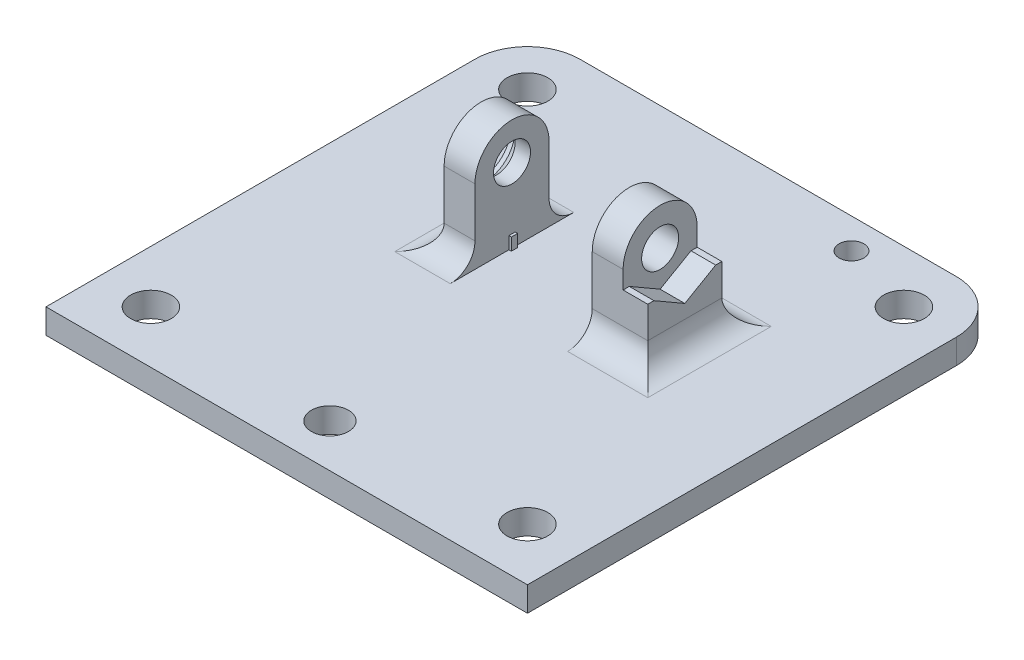
from build123d import *

# Parameters (mm, degrees)
SKETCH1_R          = 1.5
SKETCH1_R_2        = 1
SKETCH1_R_3        = 1.65
SHAPE_DEPTH        = 2
SKETCH3_W          = 2.5
SKETCH3_H          = 6
SKETCH3_W_2        = 2
SUPPORTS_DEPTH     = 9
SUPPORT_CUTS_REACH = 36.883
FILLET1_R          = 2
NUT_START          = -2
SKETCH5_R          = 1.5
NUT_HOLDER_DEPTH   = 2
SKETCH6_R          = 2.4
SCREW_CUT_DEPTH    = 0.35
SCEW_CHAMFER_SIZE  = 0.9
SKETCH7_W          = 0.5
SKETCH7_H          = 1
ANGLE_FIX_1_DEPTH  = 0.2
SKETCH8_W          = 0.5
SKETCH8_H          = 1
ANGLE_FIX_2_DEPTH  = 0.2


with BuildPart() as part:
    # Sketch1 → Shape (new body)
    with BuildSketch(Plane(origin=(0, 0, 0), x_dir=(1, 0, 0), z_dir=(0, 1, 0))):
        with BuildLine():
            Line((15.25000005, 19.5), (-15.25, 19.5))
            ThreePointArc((-15.25, 19.5), (-18.25520382, 18.25520382), (-19.5, 15.25))
            Line((-19.5, 15.25), (-19.5, -19.5))
            Line((-19.5, -19.5), (19.5, -19.5))
            Line((19.5, -19.5), (19.5, 15.25))
            ThreePointArc((19.5, 15.25), (18.255203838, 18.255203802), (15.25000005, 19.5))
        make_face()
        with Locations(Location((0, -16, 0), (0, 0, 270))):
            Circle(SKETCH1_R, mode=Mode.SUBTRACT)
        with Locations(Location((9.2, 17.05, 0), (0, 0, 270))):
            Circle(SKETCH1_R_2, mode=Mode.SUBTRACT)
        with Locations(Location((-15.25, 15.25, 0), (0, 0, 270))):
            Circle(SKETCH1_R_3, mode=Mode.SUBTRACT)
        with Locations(Location((15.25, 15.25, 0), (0, 0, 270))):
            Circle(SKETCH1_R_3, mode=Mode.SUBTRACT)
        with Locations(Location((-15.25, -15.25, 0), (0, 0, 270))):
            Circle(SKETCH1_R_3, mode=Mode.SUBTRACT)
        with Locations(Location((15.25, -15.25, 0), (0, 0, 270))):
            Circle(SKETCH1_R_3, mode=Mode.SUBTRACT)
    extrude(amount=SHAPE_DEPTH)

    # Sketch3 → Supports (add)
    with BuildSketch(Plane(origin=(0, 2, 0), x_dir=(1, 0, 0), z_dir=(0, 1, 0))):
        with Locations((-6, 3.5)):
            Rectangle(SKETCH3_W, SKETCH3_H)
        with Locations((6, 3.5)):
            Rectangle(SKETCH3_W, SKETCH3_H)
        with Locations((8.25, 3.5)):
            Rectangle(SKETCH3_W_2, SKETCH3_H)
    extrude(amount=SUPPORTS_DEPTH)

    # Support cuts: up to this face of the body (flat: up to its plane)
    support_cuts_end = Plane(part.part.faces().sort_by_distance((9.25, 6.5, -3.5))[0])
    # Sketch4 → Support cuts (cut, up to the picked face)
    with BuildSketch(Plane.ZY.offset(7.25), mode=Mode.PRIVATE) as support_cuts_sk1:
        with BuildLine():
            ThreePointArc((-2, 8), (-2.439339828, 9.060660172), (-3.5, 9.5))
            Line((-3.5, 9.5), (-3.5, 6.5))
            ThreePointArc((-3.5, 6.5), (-2.439339828, 6.939339828), (-2, 8))
        make_face()
    support_cuts_tool1 = split(extrude(support_cuts_sk1.sketch, amount=-SUPPORT_CUTS_REACH, mode=Mode.PRIVATE), bisect_by=support_cuts_end, keep=Keep.BOTH, mode=Mode.PRIVATE)
    # Sketch4 → Support cuts (cut, up to the picked face)
    with BuildSketch(Plane.ZY.offset(7.25), mode=Mode.PRIVATE) as support_cuts_sk2:
        with BuildLine():
            Line((-3.5, 6.5), (-3.5, 9.5))
            ThreePointArc((-3.5, 9.5), (-5, 8), (-3.5, 6.5))
        make_face()
    support_cuts_tool2 = split(extrude(support_cuts_sk2.sketch, amount=-SUPPORT_CUTS_REACH, mode=Mode.PRIVATE), bisect_by=support_cuts_end, keep=Keep.BOTH, mode=Mode.PRIVATE)
    # Sketch4 → Support cuts (cut, up to the picked face)
    with BuildSketch(Plane.ZY.offset(7.25), mode=Mode.PRIVATE) as support_cuts_sk3:
        with BuildLine():
            ThreePointArc((-2, 8), (-2.439339828, 9.060660172), (-3.5, 9.5))
            Line((-3.5, 9.5), (-3.5, 6.5))
            ThreePointArc((-3.5, 6.5), (-2.439339828, 6.939339828), (-2, 8))
        make_face()
    support_cuts_tool3 = split(extrude(support_cuts_sk3.sketch, amount=-SUPPORT_CUTS_REACH, mode=Mode.PRIVATE), bisect_by=support_cuts_end, keep=Keep.BOTH, mode=Mode.PRIVATE)
    # Sketch4 → Support cuts (cut, up to the picked face)
    with BuildSketch(Plane.ZY.offset(7.25), mode=Mode.PRIVATE) as support_cuts_sk4:
        with BuildLine():
            Line((-3.5, 6.5), (-3.5, 9.5))
            ThreePointArc((-3.5, 9.5), (-5, 8), (-3.5, 6.5))
        make_face()
    support_cuts_tool4 = split(extrude(support_cuts_sk4.sketch, amount=-SUPPORT_CUTS_REACH, mode=Mode.PRIVATE), bisect_by=support_cuts_end, keep=Keep.BOTH, mode=Mode.PRIVATE)
    # Sketch4 → Support cuts (cut, up to the picked face)
    with BuildSketch(Plane.ZY.offset(7.25), mode=Mode.PRIVATE) as support_cuts_sk5:
        with BuildLine():
            ThreePointArc((-6.5, 7.999999991), (-5.621320347, 10.12132034), (-3.5, 11))
            Line((-3.5, 11), (-6.5, 11))
            Line((-6.5, 11), (-6.5, 7.999999991))
        make_face()
    support_cuts_tool5 = split(extrude(support_cuts_sk5.sketch, amount=-SUPPORT_CUTS_REACH, mode=Mode.PRIVATE), bisect_by=support_cuts_end, keep=Keep.BOTH, mode=Mode.PRIVATE)
    # Sketch4 → Support cuts (cut, up to the picked face)
    with BuildSketch(Plane.ZY.offset(7.25), mode=Mode.PRIVATE) as support_cuts_sk6:
        with BuildLine():
            Line((-0.5, 11), (-3.5, 11))
            ThreePointArc((-3.5, 11), (-1.378679656, 10.121320344), (-0.5, 8))
            Line((-0.5, 8), (-0.5, 11))
        make_face()
    support_cuts_tool6 = split(extrude(support_cuts_sk6.sketch, amount=-SUPPORT_CUTS_REACH, mode=Mode.PRIVATE), bisect_by=support_cuts_end, keep=Keep.BOTH, mode=Mode.PRIVATE)
    add(support_cuts_tool1.solids().sort_by(Axis((-7.25, 8, -2.86338), (1, 0, 0)))[0], mode=Mode.SUBTRACT)
    add(support_cuts_tool2.solids().sort_by(Axis((-7.25, 8, -4.13662), (1, 0, 0)))[0], mode=Mode.SUBTRACT)
    add(support_cuts_tool3.solids().sort_by(Axis((-7.25, 8, -2.86338), (1, 0, 0)))[0], mode=Mode.SUBTRACT)
    add(support_cuts_tool4.solids().sort_by(Axis((-7.25, 8, -4.13662), (1, 0, 0)))[0], mode=Mode.SUBTRACT)
    add(support_cuts_tool5.solids().sort_by(Axis((-7.25, 10.329896, -5.829896), (1, 0, 0)))[0], mode=Mode.SUBTRACT)
    add(support_cuts_tool6.solids().sort_by(Axis((-7.25, 10.329896, -1.170104), (1, 0, 0)))[0], mode=Mode.SUBTRACT)

    # Fillet1
    fillet1_edges = [part.edges().sort_by_distance(p)[0] for p in [
        (-6, 2, -6.5),
        (-7.25, 2, -3.5),
        (-6, 2, -0.5),
        (7, 2, -0.5),
        (7, 2, -6.5),
        (9.25, 2, -3.5),
    ]]
    fillet(fillet1_edges, radius=FILLET1_R)

    # Sketch5 → Nut holder (cut)
    # profile 1 of 2: a face of its own
    with BuildSketch(Plane(origin=(9.25, 0, 0), x_dir=(0, 0, -1), z_dir=(1, 0, 0)).offset(NUT_START)):
        Polygon((1, 9.443375673), (1, 6.556624327), (3.5, 5.113248654), (6, 6.556624327), (6, 9.443375673), (3.5, 10.886751346), align=None)
        with Locations((3.5, 8)):
            Circle(SKETCH5_R, mode=Mode.SUBTRACT)
    # profile 2 of 2: a face of its own
    with BuildSketch(Plane(origin=(9.25, 0, 0), x_dir=(0, 0, -1), z_dir=(1, 0, 0)).offset(NUT_START)):
        with BuildLine():
            Line((0.5, 6.556624327), (1, 6.556624327))
            Line((1, 6.556624327), (1, 9.443375673))
            Line((1, 9.443375673), (3.5, 10.886751346))
            Line((3.5, 10.886751346), (6, 9.443375673))
            Line((6, 9.443375673), (6, 6.556624327))
            Line((6, 6.556624327), (6.5, 6.556624327))
            Line((6.5, 6.556624327), (6.5, 8))
            ThreePointArc((6.5, 8), (3.5, 11), (0.5, 8))
            Line((0.5, 8), (0.5, 6.556624327))
        make_face()
    extrude(amount=NUT_HOLDER_DEPTH, mode=Mode.SUBTRACT)

    # Sketch6 → Screw cut (cut)
    with BuildSketch(Plane.ZY.offset(7.25)):
        with Locations((-3.5, 8)):
            Circle(SKETCH6_R)
    extrude(amount=-SCREW_CUT_DEPTH, mode=Mode.SUBTRACT)

    # Scew chamfer
    scew_chamfer_edges = [part.edges().sort_by_distance(p)[0] for p in [
        (-6.9, 6.5, -3.5),
    ]]
    chamfer(scew_chamfer_edges, length=SCEW_CHAMFER_SIZE - 0.0001)  # a hair under: the kernel refuses the full size

    # Sketch7 → Angle fix 1 (add)
    with BuildSketch(Plane.ZY.offset(-4.75)):
        with Locations((-3.5, 2.5)):
            Rectangle(SKETCH7_W, SKETCH7_H)
    extrude(amount=ANGLE_FIX_1_DEPTH)

    # Sketch8 → Angle fix 2 (add)
    with BuildSketch(Plane(origin=(-4.75, 0, 0), x_dir=(0, 0, -1), z_dir=(1, 0, 0))):
        with Locations((3.5, 2.5)):
            Rectangle(SKETCH8_W, SKETCH8_H)
    extrude(amount=ANGLE_FIX_2_DEPTH)


solid = part.part
